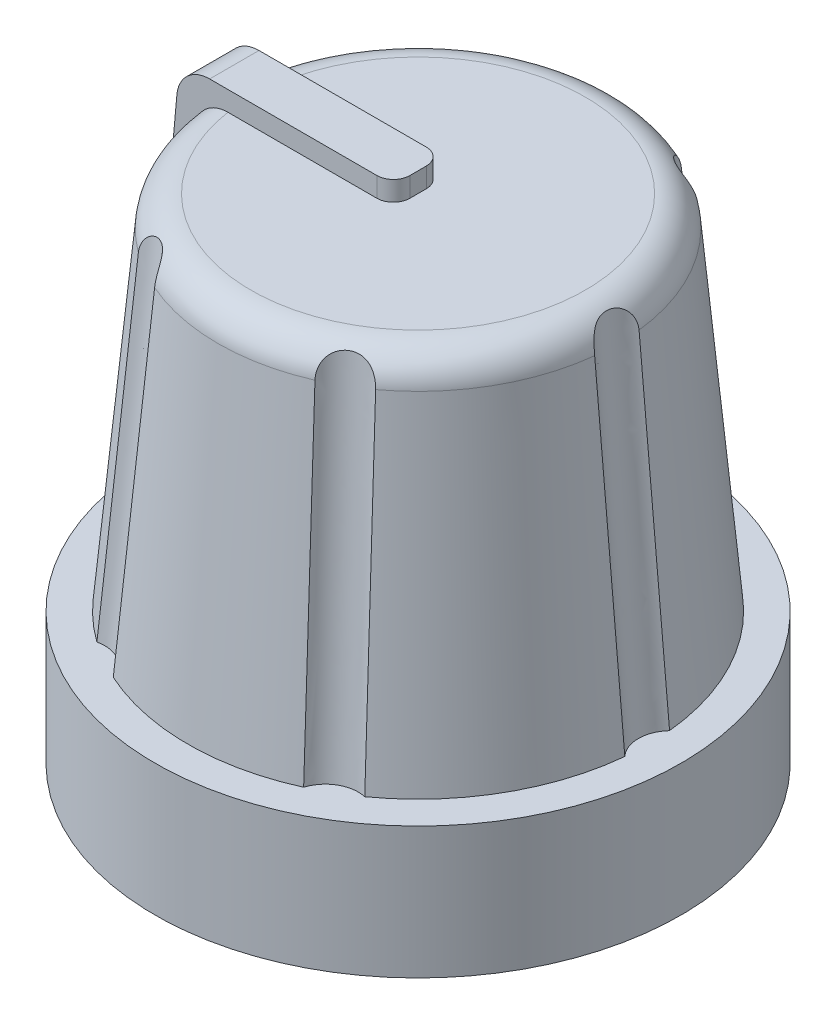
from build123d import *

# Parameters (mm, degrees)
BOSS_EXTRU_1_DEPTH           = 0.75
ESQUISSE5_R                  = 1
R_P_TITION_CIRCULAIRE1_COUNT = 6
CONG_1_R                     = 1
CONG_3_R                     = 1
CONG_2_R                     = 0.5


with BuildPart() as part:
    # Esquisse1 → Révolution1 (revolve)
    with BuildSketch(Plane.XY):
        Polygon((0, 13.5), (0, 15), (6, 15), (7, 4), (8, 4), (8, 0), (3, 0), (3, 13.5), align=None)
    revolve(axis=Axis((0, 13.5, 0), (0, 1, 0)))

    # Esquisse2 → Boss.-Extru.1 (add, symmetric)
    with BuildSketch(Plane.XY):
        Polygon((0, 13.844024699), (0, 15.6), (-6.5, 15.6), (-7.917715453, 0.005130014), (-6.239023438, 0), (-4.974172869, 13.844024699), align=None)
    extrude(amount=BOSS_EXTRU_1_DEPTH, both=True)

    # Enlèvement de matière-Balayage1: sweep along a path in Esquisse4
    with BuildLine(Plane.XY) as enl_vement_de_mati_re_balayage1_path:
        Line((6, 15), (7, 4))
    # Esquisse5 → Enlèvement de matière-Balayage1 (sweep, cut)
    with BuildSketch(Plane(origin=(0, 15, 0), x_dir=(1, 0, 0), z_dir=(0, 1, 0))):
        with Locations((6.7, 0)):
            Circle(ESQUISSE5_R)
    enl_vement_de_mati_re_balayage1 = sweep(path=enl_vement_de_mati_re_balayage1_path.line, mode=Mode.SUBTRACT)

    # Répétition circulaire1: Enlèvement de matière-Balayage1 ×6 about axis, 1 skipped
    r_p_tition_circulaire1_axis = Axis((0, 4, 0), (0, -1, 0))
    add([enl_vement_de_mati_re_balayage1.rotate(r_p_tition_circulaire1_axis, i * 360 / R_P_TITION_CIRCULAIRE1_COUNT) for i in range(1, R_P_TITION_CIRCULAIRE1_COUNT) if i not in (3,)], mode=Mode.SUBTRACT)

    # Congé1
    cong_1_edges = [part.edges().sort_by_distance(p)[0] for p in [
        (-5.177098565, 15, 3.03276284),
    ]]
    fillet(cong_1_edges, radius=CONG_1_R)

    # Congé3
    cong_3_edges = [part.edges().sort_by_distance(p)[0] for p in [
        (-6.5, 15.6, 0),
    ]]
    fillet(cong_3_edges, radius=CONG_3_R)

    # Congé2
    cong_2_edges = [part.edges().sort_by_distance(p)[0] for p in [
        (0, 15.3, -0.75),
        (0, 15.3, 0.75),
    ]]
    fillet(cong_2_edges, radius=CONG_2_R)


solid = part.part
